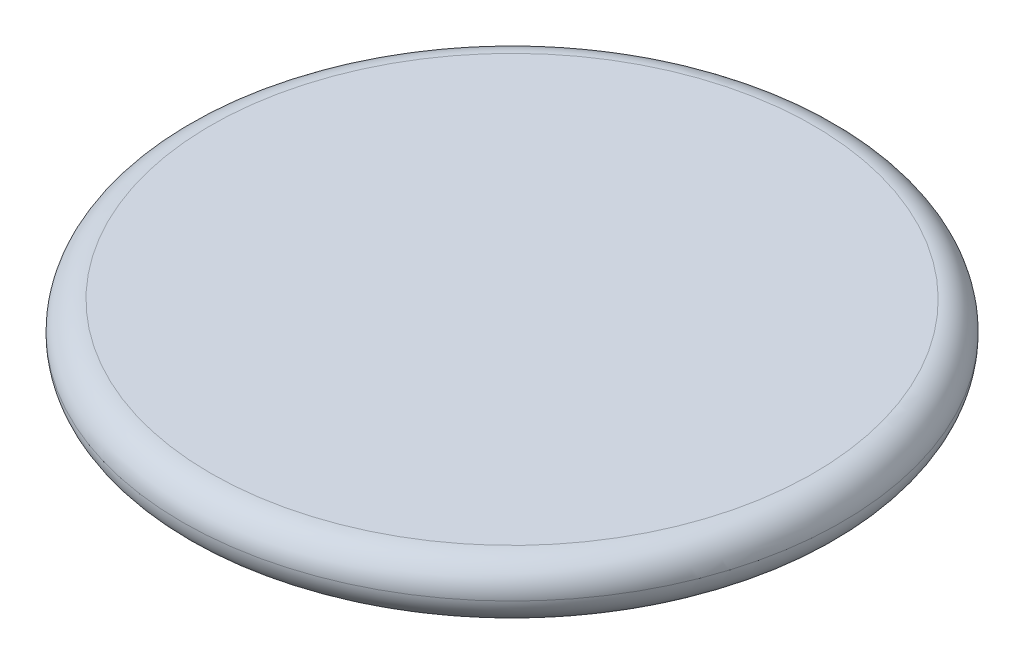
from build123d import *

# Parameters (mm, degrees)
SKETCH1_R           = 2
BOSS_EXTRUDE1_DEPTH = 10
SKETCH2_R           = 17.5
BOSS_EXTRUDE2_DEPTH = 3
FILLET1_R           = 1.5


with BuildPart() as part:
    # Sketch1 → Boss-Extrude1 (new body)
    with BuildSketch(Plane(origin=(0, 0, 0), x_dir=(1, 0, 0), z_dir=(0, 1, 0))):
        with Locations(Location((0, 0, 0), (0, 0, 270))):
            Circle(SKETCH1_R)
    extrude(amount=BOSS_EXTRUDE1_DEPTH)

    # Sketch2 → Boss-Extrude2 (add)
    with BuildSketch(Plane(origin=(0, 10, 0), x_dir=(1, 0, 0), z_dir=(0, 1, 0))):
        with Locations(Location((0, 0, 0), (0, 0, 270))):
            Circle(SKETCH2_R)
    extrude(amount=BOSS_EXTRUDE2_DEPTH)

    # Fillet1
    fillet1_edges = [part.edges().sort_by_distance(p)[0] for p in [
        (0, 10, -17.5),
        (0, 13, -17.5),
    ]]
    fillet(fillet1_edges, radius=FILLET1_R - 0.0001)  # a hair under: the kernel refuses the full size


solid = part.part
